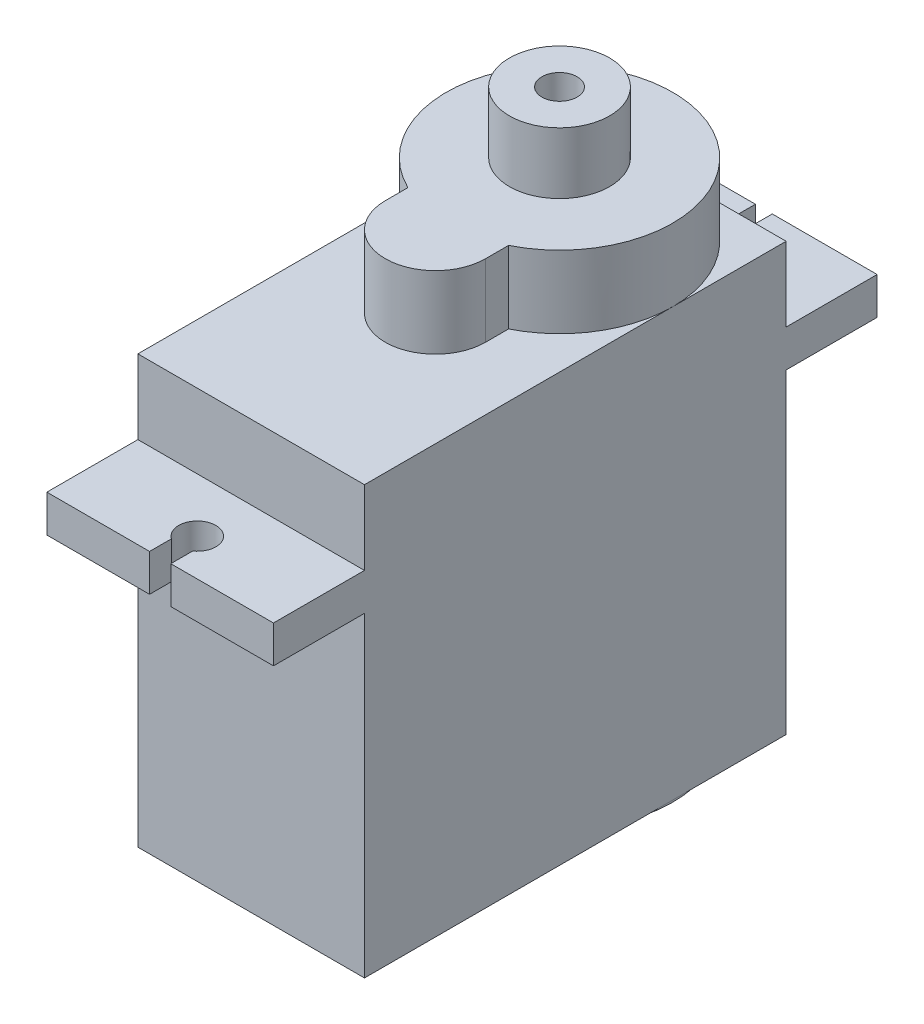
from build123d import *

# Parameters (mm, degrees)
SKETCH2_W               = 22.7
SKETCH2_H               = 23
BOSS_EXTRUDE1_DEPTH     = 12.2
BOSS_EXTRUDE2_START     = 17.106506393
BOSS_EXTRUDE2_OUTLINE_W = 12.2
BOSS_EXTRUDE2_OUTLINE_H = 4.9
BOSS_EXTRUDE2_DEPTH     = 2
SKETCH5_W               = 4.9
SKETCH5_H               = 2
BOSS_EXTRUDE4_DEPTH     = 12.2
SKETCH11_R              = 2.7
SKETCH11_R_2            = 0.95
BOSS_EXTRUDE6_DEPTH     = 27
SKETCH11_4_R            = 2.7
SKETCH11_4_R_2          = 0.95
BOSS_EXTRUDE7_DEPTH     = 30.3
CUT_EXTRUDE3_DEPTH      = 30.3
CUT_EXTRUDE4_DEPTH      = 30.3


# Read off the part's stored shape, not the designer's step: Boss-Extrude2
with BuildPart() as part:
    # Sketch2 → Boss-Extrude1 (new body)
    with BuildSketch(Plane(origin=(0, 0, 0), x_dir=(0, 0, -1), z_dir=(1, 0, 0))):
        with Locations((25.966711769, 11.60401504)):
            Rectangle(SKETCH2_W, SKETCH2_H)
    extrude(amount=BOSS_EXTRUDE1_DEPTH)

    # Boss-Extrude2 outline → Boss-Extrude2 (add)
    with BuildSketch(Plane(origin=(0, 0, 0), x_dir=(1, 0, 0), z_dir=(0, 1, 0)).offset(BOSS_EXTRUDE2_START)):
        with Locations((6.1, 12.166711769)):
            Rectangle(BOSS_EXTRUDE2_OUTLINE_W, BOSS_EXTRUDE2_OUTLINE_H)
    extrude(amount=BOSS_EXTRUDE2_DEPTH)

    # Sketch5 → Boss-Extrude4 (add)
    with BuildSketch(Plane(origin=(0, 0, 0), x_dir=(0, 0, -1), z_dir=(1, 0, 0))):
        with Locations((39.766711769, 18.10401504)):
            Rectangle(SKETCH5_W, SKETCH5_H)
    extrude(amount=BOSS_EXTRUDE4_DEPTH)

    # Sketch11 → Boss-Extrude6 (add)
    # profile 1 of 3: a face of its own
    with BuildSketch(Plane(origin=(0, 0, 0), x_dir=(1, 0, 0), z_dir=(0, 1, 0))):
        with BuildLine():
            ThreePointArc((8.818225568, 25.755828163), (6.081508494, 37.316683741), (3.414932422, 25.739448575))
            Line((3.414932422, 25.739448575), (3.414932422, 24.518358342))
            ThreePointArc((3.414932422, 24.518358342), (6.116578995, 21.816711769), (8.818225568, 24.518358342))
            Line((8.818225568, 24.518358342), (8.818225568, 25.755828163))
        make_face()
        with Locations((6.1, 31.216711769)):
            Circle(SKETCH11_R, mode=Mode.SUBTRACT)
    # profile 2 of 3: a face of its own
    with BuildSketch(Plane(origin=(0, 0, 0), x_dir=(1, 0, 0), z_dir=(0, 1, 0))):
        with Locations((6.1, 31.216711769)):
            Circle(SKETCH11_R)
        with Locations((6.1, 31.216711769)):
            Circle(SKETCH11_R_2, mode=Mode.SUBTRACT)
    # profile 3 of 3: a face of its own
    with BuildSketch(Plane(origin=(0, 0, 0), x_dir=(1, 0, 0), z_dir=(0, 1, 0))):
        with Locations((6.1, 31.216711769)):
            Circle(SKETCH11_R_2)
    extrude(amount=BOSS_EXTRUDE6_DEPTH)

    # Sketch11<4> → Boss-Extrude7 (add)
    with BuildSketch(Plane(origin=(0, 0, 0), x_dir=(1, 0, 0), z_dir=(0, 1, 0))):
        with Locations(Location((6.1, 31.216711769, 0), (0, 0, 90))):
            Circle(SKETCH11_4_R)
        with Locations(Location((6.1, 31.216711769, 0), (0, 0, 90))):
            Circle(SKETCH11_4_R_2, mode=Mode.SUBTRACT)
    extrude(amount=BOSS_EXTRUDE7_DEPTH)

    # Sketch13 → Cut-Extrude3 (cut)
    with BuildSketch(Plane(origin=(0, 0, 0), x_dir=(1, 0, 0), z_dir=(0, 1, 0))):
        with BuildLine():
            Line((5.528535179, 10.896085205), (5.528535179, 9.716711769))
            Line((5.528535179, 9.716711769), (6.671464821, 9.716711769))
            Line((6.671464821, 9.716711769), (6.671464821, 10.896085205))
            ThreePointArc((6.671464821, 10.896085205), (6.1, 12.716711769), (5.528535179, 10.896085205))
        make_face()
    extrude(amount=CUT_EXTRUDE3_DEPTH, mode=Mode.SUBTRACT)

    # Sketch16 → Cut-Extrude4 (cut)
    with BuildSketch(Plane(origin=(0, 0, 0), x_dir=(1, 0, 0), z_dir=(0, 1, 0))):
        with BuildLine():
            Line((5.646488236, 42.216711769), (6.553511764, 42.216711769))
            Line((6.553511764, 42.216711769), (6.553511764, 41.107962059))
            ThreePointArc((6.553511764, 41.107962059), (6.1, 39.216711769), (5.646488236, 41.107962059))
            Line((5.646488236, 41.107962059), (5.646488236, 42.216711769))
        make_face()
    extrude(amount=CUT_EXTRUDE4_DEPTH, mode=Mode.SUBTRACT)


solid = part.part
